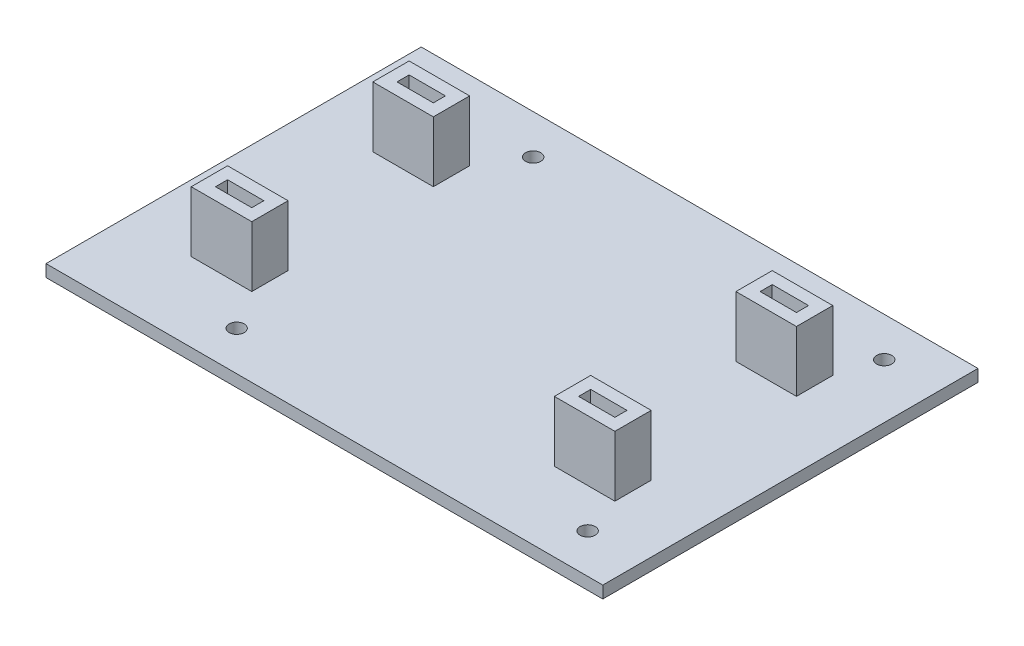
from build123d import *

# Parameters (mm, degrees)
SKETCH_1_W            = 92
SKETCH_1_H            = 62
EXTRUDE_389_DEPTH     = 2
SKETCH_2_R            = 1.25
CUT_EXTRUDE_696_DEPTH = 2
SKETCH_3_W            = 10
SKETCH_3_H            = 6
SKETCH_3_W_2          = 6
SKETCH_3_H_2          = 2
EXTRUDE_2602_DEPTH    = 10


with BuildPart() as part:
    # 草图1 → Extrude 389 (new body)
    with BuildSketch(Plane(origin=(0, 0, 0), x_dir=(1, 0, 0), z_dir=(0, 1, 0))):
        Rectangle(SKETCH_1_W, SKETCH_1_H)
    extrude(amount=EXTRUDE_389_DEPTH)

    # 草图2 → Cut-Extrude 696 (cut)
    with BuildSketch(Plane(origin=(0, 2, 0), x_dir=(1, 0, 0), z_dir=(0, 1, 0))):
        with Locations((-21, 24.5)):
            Circle(SKETCH_2_R)
        with Locations((37, 24.5)):
            Circle(SKETCH_2_R)
        with Locations((-21, -24.5)):
            Circle(SKETCH_2_R)
        with Locations((37, -24.5)):
            Circle(SKETCH_2_R)
    extrude(amount=-CUT_EXTRUDE_696_DEPTH, mode=Mode.SUBTRACT)

    # 草图3 → Extrude 2602 (add)
    # profile 1 of 4: a face of its own
    with BuildSketch(Plane(origin=(0, 2, 0), x_dir=(1, 0, 0), z_dir=(0, 1, 0))):
        with Locations((30, 15)):
            Rectangle(SKETCH_3_W, SKETCH_3_H)
        with Locations((30, 15)):
            Rectangle(SKETCH_3_W_2, SKETCH_3_H_2, mode=Mode.SUBTRACT)
    # profile 2 of 4: a face of its own
    with BuildSketch(Plane(origin=(0, 2, 0), x_dir=(1, 0, 0), z_dir=(0, 1, 0))):
        with Locations((-30, 15)):
            Rectangle(SKETCH_3_W, SKETCH_3_H)
        with Locations((-30, 15)):
            Rectangle(SKETCH_3_W_2, SKETCH_3_H_2, mode=Mode.SUBTRACT)
    # profile 3 of 4: a face of its own
    with BuildSketch(Plane(origin=(0, 2, 0), x_dir=(1, 0, 0), z_dir=(0, 1, 0))):
        with Locations((30, -15)):
            Rectangle(SKETCH_3_W, SKETCH_3_H)
        with Locations((30, -15)):
            Rectangle(SKETCH_3_W_2, SKETCH_3_H_2, mode=Mode.SUBTRACT)
    # profile 4 of 4: a face of its own
    with BuildSketch(Plane(origin=(0, 2, 0), x_dir=(1, 0, 0), z_dir=(0, 1, 0))):
        with Locations((-30, -15)):
            Rectangle(SKETCH_3_W, SKETCH_3_H)
        with Locations((-30, -15)):
            Rectangle(SKETCH_3_W_2, SKETCH_3_H_2, mode=Mode.SUBTRACT)
    extrude(amount=EXTRUDE_2602_DEPTH)


solid = part.part
